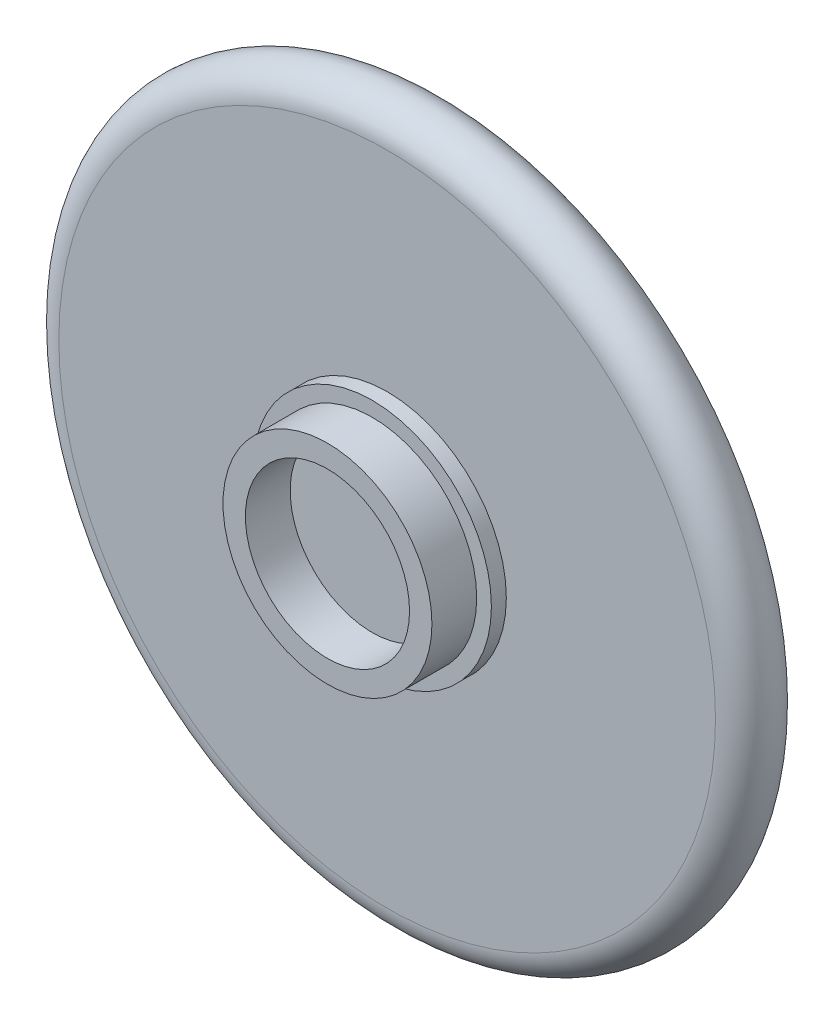
from build123d import *

# Parameters (mm, degrees)
SKETCH1_R           = 12
BOSS_EXTRUDE1_DEPTH = 2
SKETCH2_R           = 3.5
SKETCH2_R_2         = 2.75
BOSS_EXTRUDE2_DEPTH = 2
FILLET1_R           = 1
SKETCH3_R           = 2.5
BOSS_EXTRUDE3_DEPTH = 1
SKETCH4_R           = 3.992210858
BOSS_EXTRUDE4_DEPTH = 0.5


with BuildPart() as part:
    # Sketch1 → Boss-Extrude1 (new body)
    with BuildSketch(Plane.XY):
        Circle(SKETCH1_R)
    extrude(amount=BOSS_EXTRUDE1_DEPTH)

    # Sketch2 → Boss-Extrude2 (add)
    with BuildSketch(Plane.XY.offset(2)):
        Circle(SKETCH2_R)
        Circle(SKETCH2_R_2, mode=Mode.SUBTRACT)
    extrude(amount=BOSS_EXTRUDE2_DEPTH)

    # Fillet1
    fillet1_edges = [part.edges().sort_by_distance(p)[0] for p in [
        (-12, 0, 0),
        (-12, 0, 2),
    ]]
    fillet(fillet1_edges, radius=FILLET1_R - 0.0001)  # a hair under: the kernel refuses the full size

    # Sketch3 → Boss-Extrude3 (add)
    with BuildSketch(Plane(origin=(0, 0, 0), x_dir=(-1, 0, 0), z_dir=(0, 0, -1))):
        with Locations(Location((0, 0, 0), (0, 0, 180))):
            Circle(SKETCH3_R)
        with BuildLine():
            ThreePointArc((-5.067307925, -0.57653308), (-5.873937117, -1.230891086), (-6.062099925, -2.252375207))
            ThreePointArc((-6.062099925, -2.252375207), (-5.915680958, -2.687087026), (-5.644734338, -3.057223228))
            ThreePointArc((-5.644734338, -3.057223228), (-4.802200561, -3.480618607), (-3.873470329, -3.317563506))
            ThreePointArc((-3.873470329, -3.317563506), (-4.675755649, -2.036494318), (-5.067307925, -0.57653308))
        make_face()
        with BuildLine():
            ThreePointArc((-5.644734338, -3.057223228), (-5.915680958, -2.687087026), (-6.062099925, -2.252375207))
            add(Edge.make_bspline(
                [(-6.062099925, -2.252375207), (-6.026517589, -2.751047072), (-8.759907871, -2.687863498), (-5.681591245, -3.687002551), (-5.644734338, -3.057223228)],
                knots=[0, 0, 0, 0, 0.44427951, 1, 1, 1, 1], degree=3))
        make_face()
        with BuildLine():
            ThreePointArc((-1.49486588, 4.876), (-4.265918484, 2.794984703), (-5.067307925, -0.57653308))
            ThreePointArc((-5.067307925, -0.57653308), (-4.970460995, -0.547182079), (-4.871855436, -0.524427893))
            ThreePointArc((-4.871855436, -0.524427893), (-4.098627563, 2.68537746), (-1.464590045, 4.676))
            ThreePointArc((-1.464590045, 4.676), (-1.483103113, 4.775489073), (-1.49486588, 4.876))
        make_face()
        with BuildLine():
            ThreePointArc((-4.871855436, -0.524427893), (-4.970460995, -0.547182079), (-5.067307925, -0.57653308))
            ThreePointArc((-5.067307925, -0.57653308), (-4.675755649, -2.036494318), (-3.873470329, -3.317563506))
            ThreePointArc((-3.873470329, -3.317563506), (-3.786017441, -3.266643945), (-3.702196885, -3.209943649))
            ThreePointArc((-3.702196885, -3.209943649), (-4.492392683, -1.956631796), (-4.871855436, -0.524427893))
        make_face()
        with BuildLine():
            ThreePointArc((-3.702196885, -3.209943649), (-3.786017441, -3.266643945), (-3.873470329, -3.317563506))
            ThreePointArc((-3.873470329, -3.317563506), (0.01581793, -5.09997547), (3.893974917, -3.293472232))
            ThreePointArc((3.893974917, -3.293472232), (3.806118362, -3.243200717), (3.721809355, -3.187182945))
            ThreePointArc((3.721809355, -3.187182945), (0.015022472, -4.899976972), (-3.702196885, -3.209943649))
        make_face()
        with BuildLine():
            ThreePointArc((-3.084074166, -1.996563057), (-3.630573223, -0.838618346), (-4.871855436, -0.524427893))
            ThreePointArc((-4.871855436, -0.524427893), (-4.492392683, -1.956631796), (-3.702196885, -3.209943649))
            ThreePointArc((-3.702196885, -3.209943649), (-3.247508432, -2.677438992), (-3.084074166, -1.996563057))
        make_face()
        with BuildLine():
            ThreePointArc((1.49486588, 4.876), (0, 5.1), (-1.49486588, 4.876))
            ThreePointArc((-1.49486588, 4.876), (-1.483103113, 4.775489073), (-1.464590045, 4.676))
            ThreePointArc((-1.464590045, 4.676), (0, 4.9), (1.464590045, 4.676))
            ThreePointArc((1.464590045, 4.676), (1.483103113, 4.775489073), (1.49486588, 4.876))
        make_face()
        with BuildLine():
            ThreePointArc((-0.554469126, 6.393758942), (-1.275084916, 5.790036997), (-1.49486588, 4.876))
            ThreePointArc((-1.49486588, 4.876), (0, 5.1), (1.49486588, 4.876))
            ThreePointArc((1.49486588, 4.876), (1.49871592, 4.937946879), (1.5, 5))
            ThreePointArc((1.5, 5), (1.10747264, 6.011683919), (0.135327531, 6.493883014))
            ThreePointArc((0.135327531, 6.493883014), (-0.215467229, 6.484443961), (-0.554469126, 6.393758942))
        make_face()
        with BuildLine():
            ThreePointArc((5.074434577, -0.510013455), (4.695210635, -1.991230046), (3.893974917, -3.293472232))
            ThreePointArc((3.893974917, -3.293472232), (4.908886749, -3.438287773), (5.784206585, -2.904590527))
            add(Edge.make_bspline(
                [(5.865406446, -2.794015708), (5.836751545, -2.820305024), (5.809552866, -2.856598637), (5.784206585, -2.904590527)],
                knots=[0.961955758, 0.961955758, 0.961955758, 0.961955758, 1, 1, 1, 1], degree=3))
            ThreePointArc((5.865406446, -2.794015708), (6.004314758, -2.534169766), (6.090380192, -2.252375207))
            ThreePointArc((6.090380192, -2.252375207), (6.112856484, -2.103028092), (6.120373409, -1.952186319))
            ThreePointArc((6.120373409, -1.952186319), (5.831362343, -1.061421113), (5.074434577, -0.510013455))
        make_face()
        with BuildLine():
            ThreePointArc((3.721809355, -3.187182945), (3.806118362, -3.243200717), (3.893974917, -3.293472232))
            ThreePointArc((3.893974917, -3.293472232), (4.695210635, -1.991230046), (5.074434577, -0.510013455))
            ThreePointArc((5.074434577, -0.510013455), (4.97722395, -0.481798325), (4.878348324, -0.460127837))
            ThreePointArc((4.878348324, -0.460127837), (4.511084728, -1.913142593), (3.721809355, -3.187182945))
        make_face()
        with BuildLine():
            ThreePointArc((1.464590045, 4.676), (0, 4.9), (-1.464590045, 4.676))
            ThreePointArc((-1.464590045, 4.676), (0, 3.5), (1.464590045, 4.676))
        make_face()
        with BuildLine():
            add(Edge.make_bspline(
                [(-0.554469126, 6.393758942), (-1.437590662, 6.09502869), (0.002600213, 8.079848895), (-0.001852582, 7.193488902), (-0.442267062, 6.868197163), (0.135327531, 6.493883014)],
                knots=[0, 0, 0, 0, 0.556265111, 0.561970103, 1, 1, 1, 1], degree=3))
            ThreePointArc((-0.554469126, 6.393758942), (-0.215467229, 6.484443961), (0.135327531, 6.493883014))
        make_face()
        with BuildLine():
            ThreePointArc((5.1, 0), (4.100842352, 3.032011215), (1.49486588, 4.876))
            ThreePointArc((1.49486588, 4.876), (1.483103113, 4.775489073), (1.464590045, 4.676))
            ThreePointArc((1.464590045, 4.676), (3.948828385, 2.901164316), (4.9, 0))
            ThreePointArc((4.9, 0), (4.894584088, -0.230318487), (4.878348324, -0.460127837))
            ThreePointArc((4.878348324, -0.460127837), (4.97722395, -0.481798325), (5.074434577, -0.510013455))
            ThreePointArc((5.074434577, -0.510013455), (5.093604634, -0.255326906), (5.1, 0))
        make_face()
        with BuildLine():
            ThreePointArc((4.878348324, -0.460127837), (3.206344863, -1.359804857), (3.721809355, -3.187182945))
            ThreePointArc((3.721809355, -3.187182945), (4.511084728, -1.913142593), (4.878348324, -0.460127837))
        make_face()
        with BuildLine():
            ThreePointArc((6.090380192, -2.252375207), (6.004314758, -2.534169766), (5.865406446, -2.794015708))
            add(Edge.make_bspline(
                [(6.090380192, -2.252375207), (6.684980611, -1.62456302), (7.266645295, -4.471941038), (6.161555953, -2.52231461), (5.865406446, -2.794015708)],
                knots=[0, 0, 0, 0, 0.568767056, 0.961955758, 0.961955758, 0.961955758, 0.961955758], degree=3))
        make_face()
    extrude(amount=BOSS_EXTRUDE3_DEPTH)

    # Sketch4 → Boss-Extrude4 (add)
    with BuildSketch(Plane.XY.offset(2)):
        Circle(SKETCH4_R)
    extrude(amount=BOSS_EXTRUDE4_DEPTH)


solid = part.part
